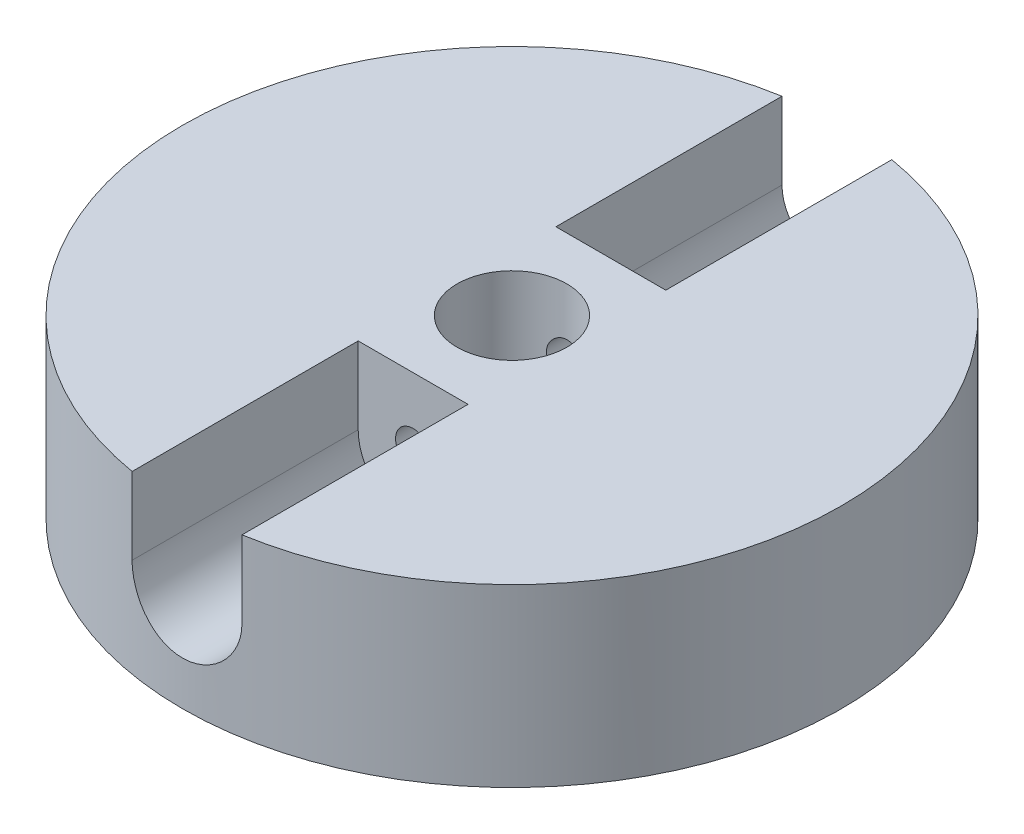
from build123d import *

# Parameters (mm, degrees)
SKETCH2_R             = 15
BOSS_EXTRUDE1_DEPTH   = 8
CUT_EXTRUDE8_DEPTH    = 15.5
CUT_EXTRUDE15_DEPTH   = 18
SKETCH3_R             = 2.5
CUT_EXTRUDE16_DEPTH   = 6
M3_TAPPED_HOLE2_D     = 2.5
M3_TAPPED_HOLE2_DEPTH = 2.5
M3_TAPPED_HOLE2_TIP   = 0.751075774
M2_TAPPED_HOLE1_D     = 1.6


with BuildPart() as part:
    # Sketch2 → Boss-Extrude1 (new body)
    with BuildSketch(Plane(origin=(0, 0, 0), x_dir=(1, 0, 0), z_dir=(0, 1, 0))):
        Circle(SKETCH2_R)
    extrude(amount=BOSS_EXTRUDE1_DEPTH)

    # Sketch9 → Cut-Extrude8 (cut)
    with BuildSketch(Plane.XY.offset(20)):
        with BuildLine():
            Line((2.5, 4.5), (2.5, 8))
            Line((2.5, 8), (-2.5, 8))
            Line((-2.5, 8), (-2.5, 4.5))
            ThreePointArc((-2.5, 4.5), (0, 2), (2.5, 4.5))
        make_face()
    extrude(amount=-CUT_EXTRUDE8_DEPTH, mode=Mode.SUBTRACT)

    # Sketch10 → Cut-Extrude15 (cut)
    with BuildSketch(Plane.XY.offset(-4.5)):
        with BuildLine():
            ThreePointArc((-2.5, 4.5), (0, 2), (2.5, 4.5))
            Line((2.5, 4.5), (2.5, 8))
            Line((2.5, 8), (-2.5, 8))
            Line((-2.5, 8), (-2.5, 4.5))
        make_face()
    extrude(amount=-CUT_EXTRUDE15_DEPTH, mode=Mode.SUBTRACT)

    # Sketch3 → Cut-Extrude16 (cut)
    with BuildSketch(Plane(origin=(0, 8, 0), x_dir=(1, 0, 0), z_dir=(0, 1, 0))):
        Circle(SKETCH3_R)
    extrude(amount=-CUT_EXTRUDE16_DEPTH, mode=Mode.SUBTRACT)

    # M3 Tapped Hole2
    with Locations(Plane(origin=(0, 0, 0), x_dir=(-1, 0, 0), z_dir=(0, -1, 0))):
        with Locations((7.071067812, -7.071067812), (-7.071067812, -7.071067812), (-7.071067812, 7.071067812), (7.071067812, 7.071067812)):
            Hole(M3_TAPPED_HOLE2_D / 2, depth=M3_TAPPED_HOLE2_DEPTH)
            with Locations((0, 0, -(M3_TAPPED_HOLE2_DEPTH + M3_TAPPED_HOLE2_TIP / 2))):  # 118° drill point
                Cone(0, M3_TAPPED_HOLE2_D / 2, M3_TAPPED_HOLE2_TIP, mode=Mode.SUBTRACT)

    # M2 Tapped Hole1 (through all)
    with Locations(Plane.XY.offset(4.5)):
        with Locations((0, 5)):
            Hole(M2_TAPPED_HOLE1_D / 2)


solid = part.part
